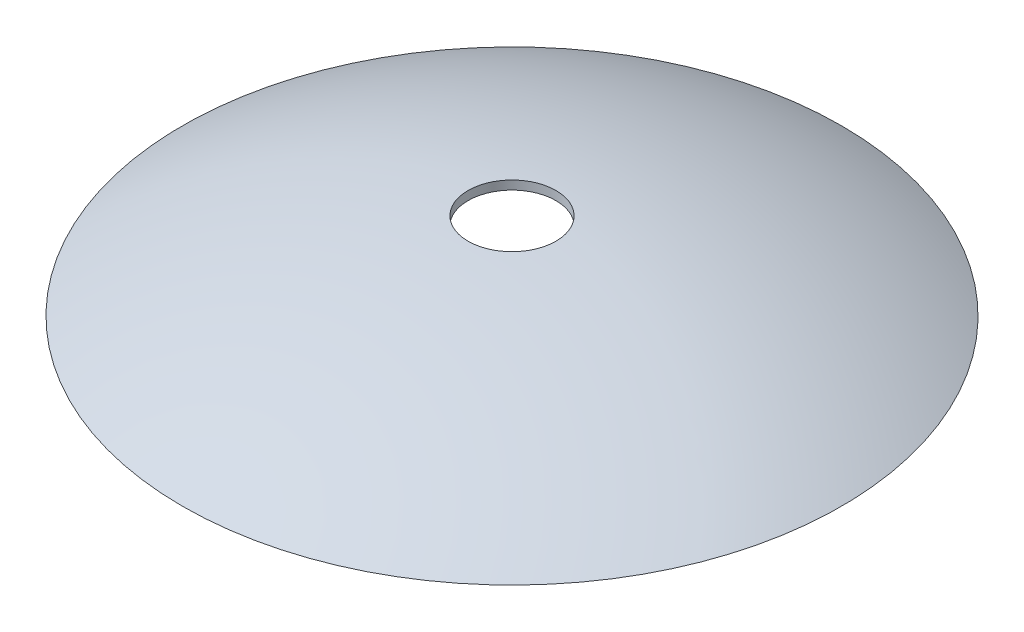
from build123d import *

# Parameters (mm, degrees)
SKETCH4_R          = 10
CUT_EXTRUDE1_DEPTH = 22


# Read off the part's stored shape, not the designer's step: Shell4
with BuildPart() as part:
    # Sketch2 → Revolve3 (revolve)
    with BuildSketch(Plane.XY):
        with BuildLine():
            ThreePointArc((-75, 0), (-38.854521396, 15.079455235), (0, 20))
            Line((0, 20), (0, 0))
            Line((0, 0), (-75, 0))
        make_face()
    revolve(axis=Axis((0, 20, 0), (0, -1, 0)))

    # Shell4 outline → Shell4 (revolve, cut)
    with BuildSketch(Plane.XY):
        with BuildLine():
            Line((0, 0), (70.959299581, 0))
            add(Edge.make_bspline(
                [(70.959299581, 0), (58.371091625, 6.969352493), (44.697655968, 12.48291706), (30.310219449, 16.202186231), (15.668630532, 18.005474405), (1.010939764, 18.005474483), (0.758094755, 18.004918806), (0.505321529, 18.00380806), (0.252622481, 18.002142877), (0, 17.999923905)],
                knots=[1.06516175, 1.06516175, 1.06516175, 1.06516175, 1.06516175, 1.06516175, 1.570703705, 1.570703705, 1.570703705, 1.570703705, 1.579579846, 1.579579846, 1.579579846, 1.579579846, 1.579579846, 1.579579846], degree=5, weights=[1, 1, 0.999596269, 0.999595367, 1, 1, 1, 1, 1, 1]))
            Line((0, 17.999923905), (0, 0))
        make_face()
    revolve(axis=Axis((0, 0, 0), (0, 1, 0)), mode=Mode.SUBTRACT)

    # Sketch4 → Cut-Extrude1 (cut)
    with BuildSketch(Plane(origin=(0, 0, 0), x_dir=(1, 0, 0), z_dir=(0, 1, 0))):
        with Locations(Location((0, 0, 0), (0, 0, 90))):
            Circle(SKETCH4_R)
    extrude(amount=CUT_EXTRUDE1_DEPTH, mode=Mode.SUBTRACT)


solid = part.part
